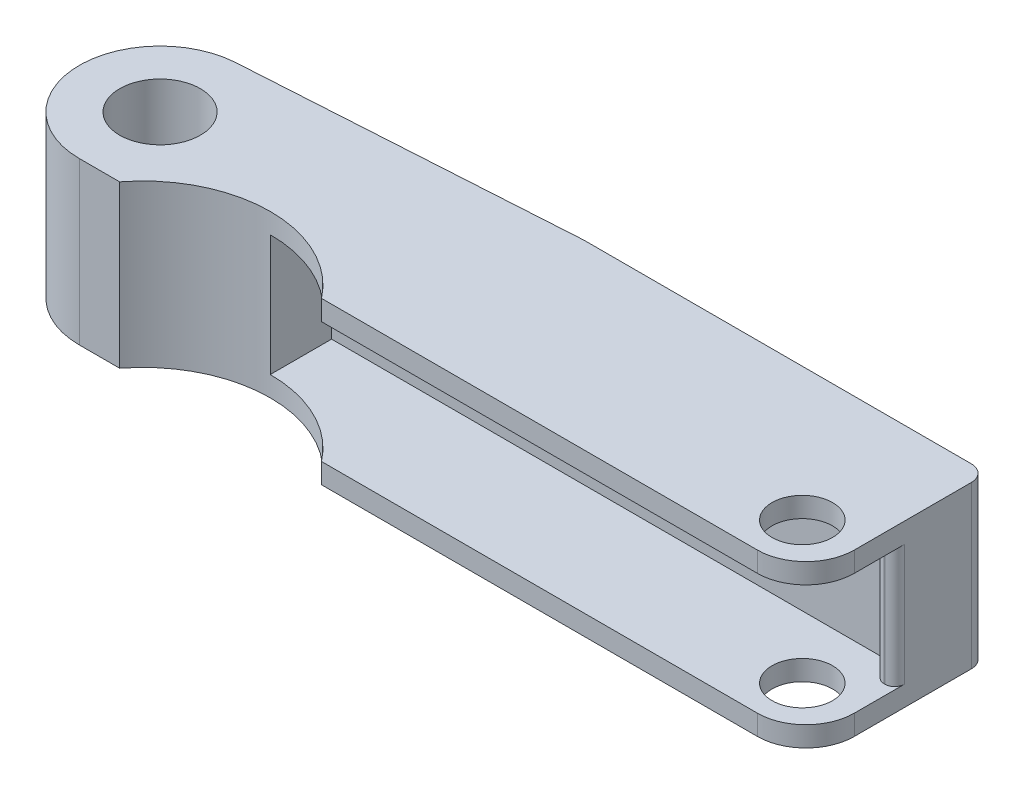
from build123d import *

# Parameters (mm, degrees)
SKETCH1_W               = 127
SKETCH1_H               = 28.575
BOSS_EXTRUDE1_DEPTH     = 25.4
CUT_EXTRUDE3_DEPTH      = 45.72
CUT_EXTRUDE3_DEPTH_BACK = 55.88
FILLET1_R               = 12.7
SKETCH6_R               = 6.35
CUT_EXTRUDE5_DEPTH      = 31.75
CUT_EXTRUDE6_DEPTH      = 31.75
SKETCH8_W               = 88.9
SKETCH8_H               = 19.05
CUT_EXTRUDE7_DEPTH      = 17.4625
FILLET2_R               = 7.62
SKETCH10_R              = 4.7625
CUT_EXTRUDE8_DEPTH      = 42.8625
SKETCH11_W              = 6.189214409
SKETCH11_H              = 19.05
SKETCH11_W_2            = 6.35
CUT_EXTRUDE10_DEPTH     = 8.0645
FILLET3_R               = 1.524
FILLET4_R               = 2.54


with BuildPart() as part:
    # Sketch1 → Boss-Extrude1 (new body)
    with BuildSketch(Plane(origin=(0, 0, 0), x_dir=(1, 0, 0), z_dir=(0, 1, 0))):
        with Locations((63.5, 14.2875)):
            Rectangle(SKETCH1_W, SKETCH1_H)
    extrude(amount=BOSS_EXTRUDE1_DEPTH)

    # Sketch5 → Cut-Extrude3 (cut, two sides: drawn at the far end of the back side and taken through both)
    with BuildSketch(Plane(origin=(0, 25.4, 0), x_dir=(1, 0, 0), z_dir=(0, 1, 0)).offset(-CUT_EXTRUDE3_DEPTH_BACK)):
        with BuildLine():
            Line((19.05, 0), (50.8, 0))
            ThreePointArc((50.8, 0), (34.925, 7.816775665), (19.05, 0))
        make_face()
    extrude(amount=CUT_EXTRUDE3_DEPTH + CUT_EXTRUDE3_DEPTH_BACK, mode=Mode.SUBTRACT)

    # Fillet1
    fillet1_edges = [part.edges().sort_by_distance(p)[0] for p in [
        (0, 12.7, -28.575),
        (0, 12.7, 0),
    ]]
    fillet(fillet1_edges, radius=FILLET1_R)

    # Sketch6 → Cut-Extrude5 (cut)
    with BuildSketch(Plane(origin=(0, 25.4, 0), x_dir=(1, 0, 0), z_dir=(0, 1, 0))):
        with Locations(Location((12.7, 12.7, 0), (0, 0, 270))):
            Circle(SKETCH6_R)
    extrude(amount=-CUT_EXTRUDE5_DEPTH, mode=Mode.SUBTRACT)

    # Sketch7 → Cut-Extrude6 (cut)
    with BuildSketch(Plane(origin=(0, 25.4, 0), x_dir=(1, 0, 0), z_dir=(0, 1, 0))):
        with BuildLine():
            Line((11.913860826, 25.375645356), (63.5, 28.575))
            Line((63.5, 28.575), (12.7, 28.575))
            ThreePointArc((12.7, 28.575), (3.719743879, 24.855256121), (0, 15.875))
            Line((0, 15.875), (0, 12.7))
            ThreePointArc((0, 12.7), (3.445974727, 21.397874237), (11.913860826, 25.375645356))
        make_face()
    extrude(amount=-CUT_EXTRUDE6_DEPTH, mode=Mode.SUBTRACT)

    # Sketch8 → Cut-Extrude7 (cut)
    with BuildSketch(Plane.XY):
        with Locations((79.375, 12.7)):
            Rectangle(SKETCH8_W, SKETCH8_H)
    extrude(amount=-CUT_EXTRUDE7_DEPTH, mode=Mode.SUBTRACT)

    # Fillet2
    # the kernel refuses this fillet: 7.62 mm, written as the material it takes off along each edge
    with BuildSketch(Plane(origin=(127, -19.05, 0), x_dir=(-1, 0, 0), z_dir=(0, 1, 0))) as fillet2_piece_1:
        with BuildLine():
            CenterArc((FILLET2_R, -FILLET2_R), FILLET2_R, 90, 90)
            Line((0, -FILLET2_R), (0, 0))
            Line((0, 0), (FILLET2_R, 0))
        make_face()
    extrude(amount=63.5, mode=Mode.SUBTRACT)

    # Sketch10 → Cut-Extrude8 (cut)
    with BuildSketch(Plane.XZ):
        with Locations(Location((118.820602805, -7.62, 0), (0, 0, 270))):
            Circle(SKETCH10_R)
    extrude(amount=-CUT_EXTRUDE8_DEPTH, mode=Mode.SUBTRACT)

    # Sketch11 → Cut-Extrude10 (cut)
    with BuildSketch(Plane(origin=(127, 0, 0), x_dir=(0, 0, -1), z_dir=(1, 0, 0))):
        with Locations((4.525392796, 12.7)):
            Rectangle(SKETCH11_W, SKETCH11_H)
        with Locations((10.795, 12.7)):
            Rectangle(SKETCH11_W_2, SKETCH11_H)
    extrude(amount=-CUT_EXTRUDE10_DEPTH, mode=Mode.SUBTRACT)

    # Fillet3
    fillet3_edges = [part.edges().sort_by_distance(p)[0] for p in [
        (123.825, 12.7, -13.97),
        (127, 12.7, -13.97),
        (123.825, 12.7, -17.4625),
    ]]
    fillet(fillet3_edges, radius=FILLET3_R)

    # Fillet4
    fillet4_edges = [part.edges().sort_by_distance(p)[0] for p in [
        (127, 12.7, -28.575),
    ]]
    fillet(fillet4_edges, radius=FILLET4_R)


solid = part.part
